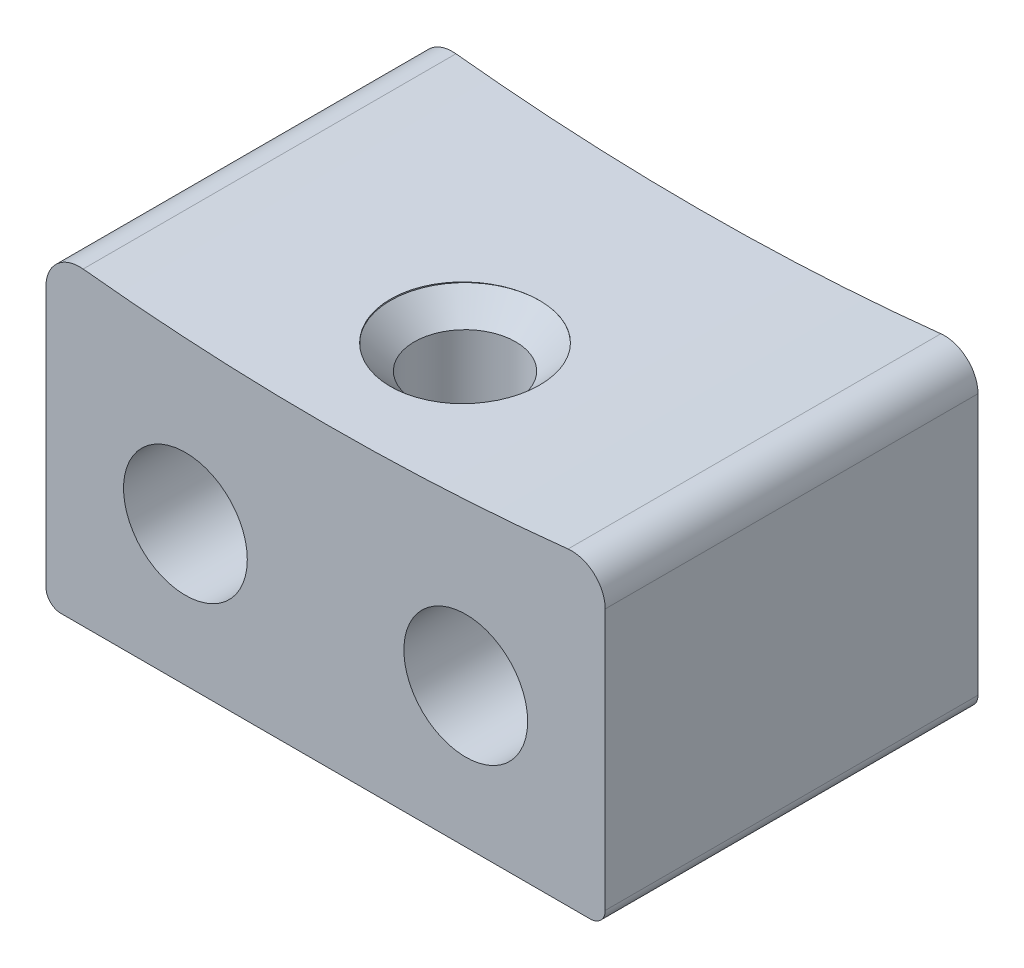
from build123d import *
from build123d.topology import SkipClean

# Parameters (mm, degrees)
BOSS_EXTRUDE1_DEPTH             = 12.7
F_19_0_166_DIAMETER_HOLE1_D     = 4.2164
F_19_0_166_DIAMETER_HOLE1_DEPTH = 15.875
F_19_0_166_DIAMETER_HOLE1_TIP   = 1.266734357


# Read off the part's stored shape, not the designer's step: #8-32 Tapped Hole1
with BuildPart() as part:
    # Sketch1 → Boss-Extrude1 (new body)
    with BuildSketch(Plane.XY):
        with BuildLine():
            Line((9.525, -77.909402237), (9.525, -86.8045))
            ThreePointArc((9.525, -86.8045), (9.376210245, -87.163710245), (9.017, -87.3125))
            Line((9.017, -87.3125), (-9.017, -87.3125))
            ThreePointArc((-9.017, -87.3125), (-9.376210245, -87.163710245), (-9.525, -86.8045))
            Line((-9.525, -86.8045), (-9.525, -77.909402237))
            ThreePointArc((-9.525, -77.909402237), (-9.145773261, -77.059049719), (-8.259734198, -76.77296039))
            ThreePointArc((-8.259734198, -76.77296039), (0, -77.216), (8.259734198, -76.77296039))
            ThreePointArc((8.259734198, -76.77296039), (9.145773261, -77.059049719), (9.525, -77.909402237))
        make_face()
    extrude(amount=BOSS_EXTRUDE1_DEPTH)

    # #19 (0.166) Diameter Hole1
    with Locations(Plane.XY.offset(12.7)):
        with Locations((4.7752, -82.55), (-4.7752, -82.55)):
            Hole(F_19_0_166_DIAMETER_HOLE1_D / 2, depth=F_19_0_166_DIAMETER_HOLE1_DEPTH)
            with Locations((0, 0, -(F_19_0_166_DIAMETER_HOLE1_DEPTH + F_19_0_166_DIAMETER_HOLE1_TIP / 2))):  # 118° drill point
                Cone(0, F_19_0_166_DIAMETER_HOLE1_D / 2, F_19_0_166_DIAMETER_HOLE1_TIP, mode=Mode.SUBTRACT)

    # #8-32 Tapped Hole1 outline → #8-32 Tapped Hole1 (revolve, cut)
    with SkipClean():  # the faces are left unmerged after this step: merging them gives an invalid solid
        with BuildSketch(Plane.XY.offset(7.9502)):
            Polygon((2.54, -77.216), (2.54, -77.174195215), (0, -77.174194503), (0, -87.3125), (2.286, -87.3125), (1.7272, -86.7537), (1.7272, -78.0288), align=None)
        revolve(axis=Axis((0, 0, 7.9502), (0, 1, 0)), mode=Mode.SUBTRACT)


solid = part.part
